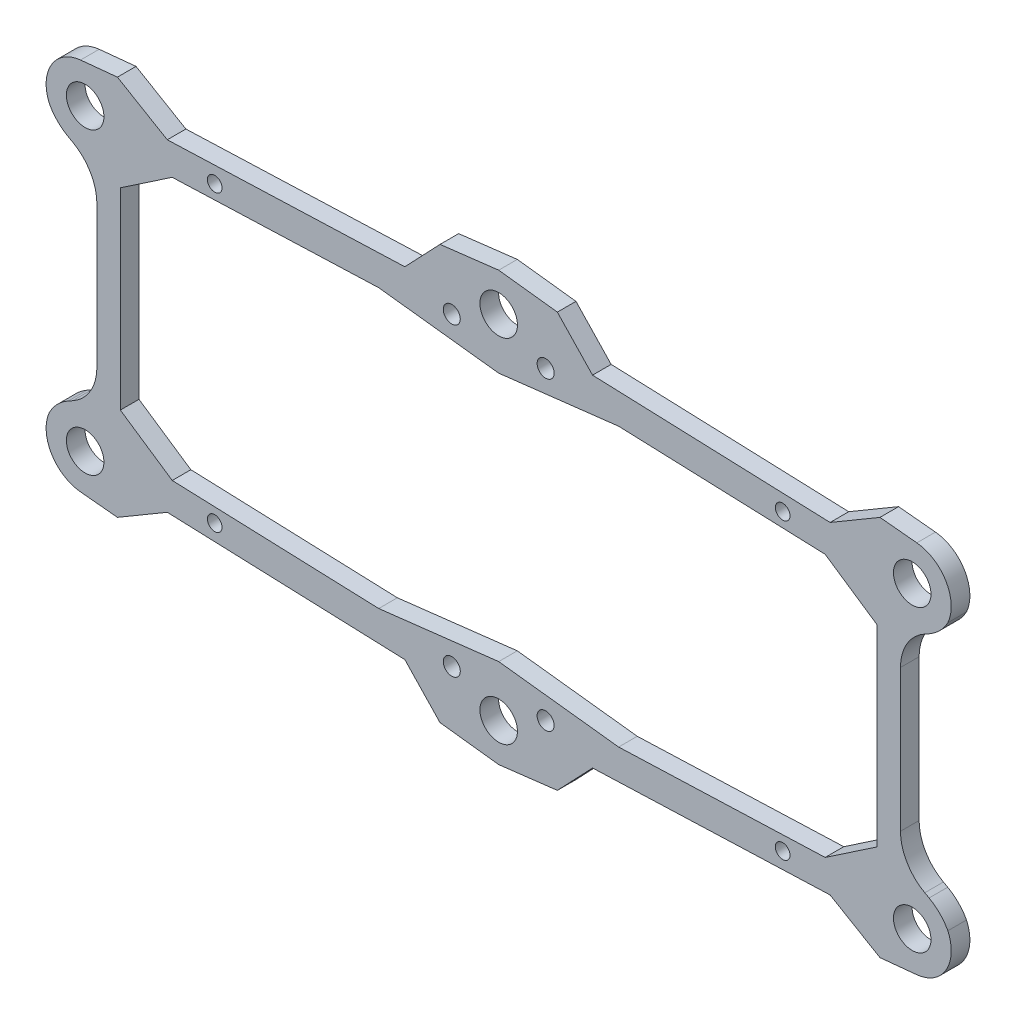
from build123d import *

# Parameters (mm, degrees)
SKETCH1_R           = 3.2
BOSS_EXTRUDE1_DEPTH = 3.175
SKETCH3_R           = 3.2
BOSS_EXTRUDE2_DEPTH = 3.175
FILLET1_R           = 6.5
SKETCH6_R           = 1.45
CUT_EXTRUDE4_DEPTH  = 86.409103367
CUT_EXTRUDE14_DEPTH = 86.409103367
CUT_EXTRUDE13_DEPTH = 86.409103367
FILLET2_R           = 8
SKETCH9_R           = 1.25
CUT_EXTRUDE15_DEPTH = 86.409103367


with BuildPart() as part:
    # Sketch1 → Boss-Extrude1 (new body)
    with BuildSketch(Plane.XY):
        Polygon((0, 36.5), (-10, 35.30709832), (-16, 29), (-56.5, 27.5), (-76.5, 14), (-76.5, -14), (-56.5, -27.5), (-16, -29), (-10, -35.30709832), (0, -36.5), (10, -35.30709832), (16, -29), (56.5, -27.5), (76.5, -14), (76.5, 14), (56.5, 27.5), (16, 29), (10, 35.30709832), align=None)
        with Locations((0, 30)):
            Circle(SKETCH1_R, mode=Mode.SUBTRACT)
        with Locations(Location((0, -30, 0), (0, 0, 180))):
            Circle(SKETCH1_R, mode=Mode.SUBTRACT)
    extrude(amount=BOSS_EXTRUDE1_DEPTH)

    # Sketch3 → Boss-Extrude2 (add)
    # profile 1 of 4: a face of its own
    with BuildSketch(Plane.XY.offset(3.175)):
        Polygon((-56.5, 27.5), (-65, 32.5), (-80.3, 31), (-73.537037037, 16), align=None)
        with Locations((-70.5, 25.5)):
            Circle(SKETCH3_R, mode=Mode.SUBTRACT)
    # profile 2 of 4: a face of its own
    with BuildSketch(Plane.XY.offset(3.175)):
        Polygon((73.537037037, 16), (56.5, 27.5), (65, 32.5), (80.3, 31), align=None)
        with Locations(Location((70.5, 25.5, 0), (0, 0, 180))):
            Circle(SKETCH3_R, mode=Mode.SUBTRACT)
    # profile 3 of 4: a face of its own
    with BuildSketch(Plane.XY.offset(3.175)):
        Polygon((56.5, -27.5), (65, -32.5), (80.3, -31), (73.537037037, -16), align=None)
        with Locations((70.5, -25.5)):
            Circle(SKETCH3_R, mode=Mode.SUBTRACT)
    # profile 4 of 4: a face of its own
    with BuildSketch(Plane.XY.offset(3.175)):
        Polygon((-73.537037037, -16), (-56.5, -27.5), (-65, -32.5), (-80.3, -31), align=None)
        with Locations(Location((-70.5, -25.5, 0), (0, 0, 180))):
            Circle(SKETCH3_R, mode=Mode.SUBTRACT)
    extrude(amount=-BOSS_EXTRUDE2_DEPTH)

    # Fillet1
    fillet1_edges = [part.edges().sort_by_distance(p)[0] for p in [
        (-80.3, 31, 1.5875),
        (80.3, 31, 1.5875),
        (80.3, -31, 1.5875),
        (-80.3, -31, 1.5875),
    ]]
    fillet(fillet1_edges, radius=FILLET1_R)

    # Sketch6 → Cut-Extrude4 (cut, through all)
    with BuildSketch(Plane(origin=(0, 0, 0), x_dir=(-1, 0, 0), z_dir=(0, 0, -1))):
        with Locations((8, 26)):
            Circle(SKETCH6_R)
        with Locations((-8, 26)):
            Circle(SKETCH6_R)
        with Locations((-8, -26)):
            Circle(SKETCH6_R)
        with Locations((8, -26)):
            Circle(SKETCH6_R)
    extrude(amount=-CUT_EXTRUDE4_DEPTH, mode=Mode.SUBTRACT)

    # Sketch8 → Cut-Extrude14 (cut, through all)
    with BuildSketch(Plane.XY.offset(3.175)):
        Polygon((-75.690069736, 20.775346347), (-68.5, 16.819040498), (-68.5, -16.819040498), (-75.690069736, -20.775346347), (-83.497643109, -20.775346347), (-83.497643109, 20.775346347), align=None)
        Polygon((75.690069736, -20.775346347), (68.5, -16.819040498), (68.5, 16.819040498), (75.690069736, 20.775346347), (83.497643109, 20.775346347), (83.497643109, -20.775346347), align=None)
    extrude(amount=-CUT_EXTRUDE14_DEPTH, mode=Mode.SUBTRACT)

    # Sketch7 → Cut-Extrude13 (cut, through all)
    with BuildSketch(Plane.XY.offset(3.175)):
        Polygon((0, 21.290184322), (-20.449646359, 23.681667258), (-55.655570018, 22.377744159), (-64.5, 16.407753921), (-64.5, -16.407753921), (-55.655570018, -22.377744159), (-20.449646359, -23.681667258), (0, -21.290184322), (20.449646359, -23.681667258), (55.655570018, -22.377744159), (64.5, -16.407753921), (64.5, 16.407753921), (55.655570018, 22.377744159), (20.449646359, 23.681667258), align=None)
    extrude(amount=-CUT_EXTRUDE13_DEPTH, mode=Mode.SUBTRACT)

    # Fillet2
    # the kernel refuses this fillet: 8 mm, written as the material it adds along each edge
    with BuildSketch(Plane(origin=(68.5, 16.819040498, 3.175), x_dir=(0.8761249486576493, 0.48208409467605473, 0), z_dir=(0, 0, -1)), Plane(origin=(68.5, -16.819040498, 3.175), x_dir=(0, 1, 0), z_dir=(0, 0, -1))) as fillet2_piece_1:
        with BuildLine():
            CenterArc((FILLET2_R * 0.591143884348, FILLET2_R), FILLET2_R, 208.821606211, 61.178393789)
            Line((-FILLET2_R * 0.284981064309, FILLET2_R * 0.517915905324), (0, 0))
            Line((0, 0), (FILLET2_R * 0.591143884348, 0))
        make_face()
    extrude(amount=3.175)
    with BuildSketch(Plane(origin=(-68.5, -16.819040498, 3.175), x_dir=(0, 1, 0), z_dir=(0, 0, -1)), Plane(origin=(-68.5, 16.819040498, 3.175), x_dir=(-0.8761249486576493, 0.48208409467605473, 0), z_dir=(0, 0, -1))) as fillet2_piece_2:
        with BuildLine():
            CenterArc((FILLET2_R * 0.591143884348, -FILLET2_R), FILLET2_R, 90, 61.178393789)
            Line((-FILLET2_R * 0.284981064309, -FILLET2_R * 0.517915905324), (0, 0))
            Line((0, 0), (FILLET2_R * 0.591143884348, 0))
        make_face()
    extrude(amount=3.175)
    # the kernel refuses this fillet: 8 mm, written as the material it takes off along each edge
    with BuildSketch(Plane(origin=(75.690069736, 20.775346347, 9.774776334), x_dir=(0.4110197276210946, 0.911626449542948, 0), z_dir=(0, 0, -1))) as fillet2_2_piece_1:
        with BuildLine():
            CenterArc((2.693587302, -7.982087138), FILLET2_R, 93.834919038, 33.074566144)
            Line((-2.110833522, -1.585405143), (0, 0))
            Line((0, 0), (2.158531299, 0))
        make_face()
    extrude(amount=16.374552669, mode=Mode.SUBTRACT)
    with BuildSketch(Plane(origin=(75.690069736, -20.775346347, 9.774776334), x_dir=(-0.8761249486576492, 0.48208409467605506, 0), z_dir=(0, 0, -1))) as fillet2_2_piece_2:
        with BuildLine():
            CenterArc((2.639910534, -8), FILLET2_R, 90, 33.074566144)
            Line((-1.725929787, -1.29631159), (0, 0))
            Line((0, 0), (2.639910534, 0))
        make_face()
    extrude(amount=16.374552669, mode=Mode.SUBTRACT)
    with BuildSketch(Plane(origin=(-75.690069736, -20.775346347, 9.774776334), x_dir=(0.8761249486576499, 0.48208409467605357, 0), z_dir=(0, 0, -1))) as fillet2_2_piece_3:
        with BuildLine():
            CenterArc((2.639910534, 8), FILLET2_R, 236.925433856, 33.074566144)
            Line((-1.725929787, 1.29631159), (0, 0))
            Line((0, 0), (2.639910534, 0))
        make_face()
    extrude(amount=16.374552669, mode=Mode.SUBTRACT)
    with BuildSketch(Plane(origin=(-75.690069736, 20.775346347, 9.774776334), x_dir=(-0.4110197276210959, 0.9116264495429475, 0), z_dir=(0, 0, -1))) as fillet2_2_piece_4:
        with BuildLine():
            CenterArc((2.693587302, 7.982087138), FILLET2_R, 233.090514818, 33.074566144)
            Line((-2.110833522, 1.585405143), (0, 0))
            Line((0, 0), (2.158531299, 0))
        make_face()
    extrude(amount=16.374552669, mode=Mode.SUBTRACT)

    # Sketch9 → Cut-Extrude15 (cut, through all)
    with BuildSketch(Plane.XY.offset(3.175)):
        with Locations((-48.411790338, 25.054530897)):
            Circle(SKETCH9_R)
        with Locations(Location((48.411790338, 25.054530897, 0), (0, 0, 180))):
            Circle(SKETCH9_R)
        with Locations(Location((-48.411790338, -25.054530897, 0), (0, 0, 180))):
            Circle(SKETCH9_R)
        with Locations((48.411790338, -25.054530897)):
            Circle(SKETCH9_R)
    extrude(amount=-CUT_EXTRUDE15_DEPTH, mode=Mode.SUBTRACT)


solid = part.part
